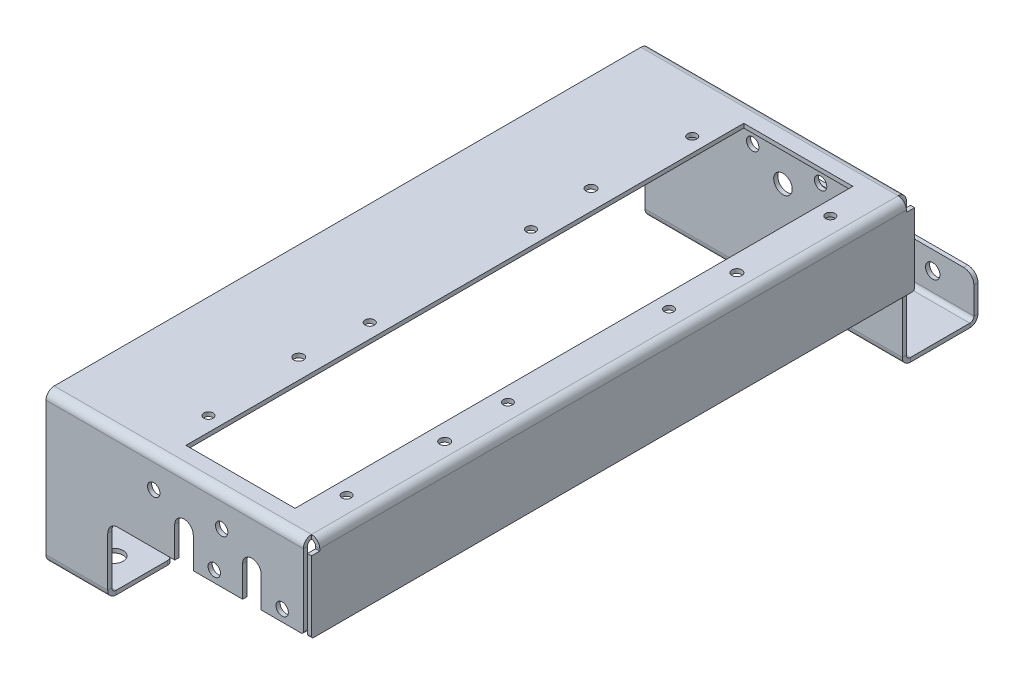
from build123d import *

# Parameters (mm, degrees)
BASE_FLANGE1_DEPTH            = 2
EDGE_FLANGE1_DEPTH            = 125
EDGE_FLANGE2_DEPTH            = 30
EDGE_FLANGE3_STRIP_W          = 12
EDGE_FLANGE3_STRIP_H          = 2
EDGE_FLANGE3_STRIP_CUT_DEPTH  = 125
EDGE_FLANGE3_DEPTH            = 125
EDGE_FLANGE4_STRIP_W          = 12
EDGE_FLANGE4_STRIP_H          = 2
EDGE_FLANGE4_STRIP_CUT_DEPTH  = 125
EDGE_FLANGE4_DEPTH            = 125
SKETCH19_W                    = 53
SKETCH19_H                    = 271
CUT_EXTRUDE2_DEPTH            = 4
M4_CLEARANCE_HOLE1_AT_2_COUNT = 2
M4_CLEARANCE_HOLE1_AT_2_PITCH = 78.333333333
M4_CLEARANCE_HOLE1_AT_3_COUNT = 2
M4_CLEARANCE_HOLE1_AT_3_PITCH = 156.666666667
M4_CLEARANCE_HOLE1_AT_4_COUNT = 2
M4_CLEARANCE_HOLE1_AT_4_PITCH = 235
M4_CLEARANCE_HOLE2_D          = 4.8
SKETCH25_R                    = 4.5
CUT_EXTRUDE3_DEPTH            = 10
CUT_EXTRUDE4_START            = -2
SKETCH26_R                    = 4.5
CUT_EXTRUDE4_DEPTH            = 2
F_6_0_6_DIAMETER_HOLE1_D      = 6
M8_CLEARANCE_HOLE1_D          = 9
M8_CLEARANCE_HOLE1_DEPTH      = 2
FILLET3_R                     = 3
M8_CLEARANCE_HOLE2_D          = 9
EDGE_FLANGE5_DEPTH            = 82.996938457
F_7_0_7_DIAMETER_HOLE1_D      = 7
F_7_0_7_DIAMETER_HOLE1_DEPTH  = 2
FILLET4_R                     = 5
EDGE_FLANGE6_DEPTH            = 285
EDGE_FLANGE6_START            = -2
EDGE_FLANGE6_FLAT_DEPTH       = 2
FILLET5_R                     = 1
FILLET6_R                     = 3


# Sheet-metal steps are written as plain solids
with BuildPart() as part:
    # Sketch1 → Base-Flange1 (new body)
    with BuildSketch(Plane.XY):
        with BuildLine():
            Line((15, 0), (-15, 0))
            Line((-15, 0), (-15, 65))
            Line((-15, 65), (110, 65))
            Line((110, 65), (110, 29))
            Line((110, 29), (20, 29))
            ThreePointArc((20, 29), (16.464466094, 27.535533906), (15, 24))
            Line((15, 24), (15, 0))
        make_face()
    extrude(amount=-BASE_FLANGE1_DEPTH)

    # Edge-Flange1 section (across the edge) → Edge-Flange1 (add)
    with BuildSketch(Plane(origin=(-15, 67, -2), x_dir=(0, -1, 0), z_dir=(1, 0, 0))):
        with BuildLine():
            Line((-2, 2), (-2, 289))
            Line((-2, 289), (0, 289))
            Line((0, 289), (0, 2))
            ThreePointArc((0, 2), (0.585786438, 0.585786438), (2, 0))
            Line((2, 0), (2, -2))
            ThreePointArc((2, -2), (-0.828427125, -0.828427125), (-2, 2))
        make_face()
    extrude(amount=EDGE_FLANGE1_DEPTH)

    # Edge-Flange2 section (across the edge) → Edge-Flange2 (add)
    with BuildSketch(Plane(origin=(15, -2, -2), x_dir=(0, 1, 0), z_dir=(-1, 0, 0))):
        with BuildLine():
            Line((-2, 2), (-2, 30))
            Line((-2, 30), (0, 30))
            Line((0, 30), (0, 2))
            ThreePointArc((0, 2), (0.585786438, 0.585786438), (2, 0))
            Line((2, 0), (2, -2))
            ThreePointArc((2, -2), (-0.828427125, -0.828427125), (-2, 2))
        make_face()
    extrude(amount=EDGE_FLANGE2_DEPTH)

    # Edge-Flange3 strip (across the edge) → Edge-Flange3 strip cut (cut)
    with BuildSketch(Plane(origin=(-15, 67, -291), x_dir=(0, 0, 1), z_dir=(1, 0, 0))):
        with Locations((-4, -1)):
            Rectangle(EDGE_FLANGE3_STRIP_W, EDGE_FLANGE3_STRIP_H)
    extrude(amount=EDGE_FLANGE3_STRIP_CUT_DEPTH, mode=Mode.SUBTRACT)

    # Edge-Flange3 section (across the edge) → Edge-Flange3 (add)
    with BuildSketch(Plane(origin=(-15, 67, -291), x_dir=(0, 0, 1), z_dir=(1, 0, 0))):
        with BuildLine():
            Line((-2, 2), (-2, 69))
            Line((-2, 69), (0, 69))
            Line((0, 69), (0, 2))
            ThreePointArc((0, 2), (0.585786438, 0.585786438), (2, 0))
            Line((2, 0), (2, -2))
            ThreePointArc((2, -2), (-0.828427125, -0.828427125), (-2, 2))
        make_face()
    extrude(amount=EDGE_FLANGE3_DEPTH)

    # Edge-Flange4 strip (across the edge) → Edge-Flange4 strip cut (cut)
    with BuildSketch(Plane(origin=(110, -2, -293), x_dir=(0, 1, 0), z_dir=(-1, 0, 0))):
        with Locations((-4, -1)):
            Rectangle(EDGE_FLANGE4_STRIP_W, EDGE_FLANGE4_STRIP_H)
    extrude(amount=EDGE_FLANGE4_STRIP_CUT_DEPTH, mode=Mode.SUBTRACT)

    # Edge-Flange4 section (across the edge) → Edge-Flange4 (add)
    with BuildSketch(Plane(origin=(110, -2, -293), x_dir=(0, 1, 0), z_dir=(-1, 0, 0))):
        with BuildLine():
            Line((-2, 2), (-2, 30.8))
            Line((-2, 30.8), (0, 30.8))
            Line((0, 30.8), (0, 2))
            ThreePointArc((0, 2), (0.585786438, 0.585786438), (2, 0))
            Line((2, 0), (2, -2))
            ThreePointArc((2, -2), (-0.828427125, -0.828427125), (-2, 2))
        make_face()
    extrude(amount=EDGE_FLANGE4_DEPTH)

    # Sketch19 → Cut-Extrude2 (cut)
    with BuildSketch(Plane(origin=(0, 69, 0), x_dir=(1, 0, 0), z_dir=(0, 1, 0))):
        with Locations((68.5, 146.5)):
            Rectangle(SKETCH19_W, SKETCH19_H)
    extrude(amount=-CUT_EXTRUDE2_DEPTH, mode=Mode.SUBTRACT)

    # Sketch22 → M4 Clearance Hole1 (revolve, cut)
    with BuildSketch(Plane(origin=(102.041079456, 69, -264), x_dir=(0, 0, 1), z_dir=(1, 0, 0))):
        Polygon((0, 0), (0, 5.351936393), (2.25, 4), (2.25, 0), align=None)
    m4_clearance_hole1 = revolve(axis=Axis((102.041079456, 75.35, -264), (0, -1, 0)), mode=Mode.SUBTRACT)

    # M4 Clearance Hole1 at 2: M4 Clearance Hole1 ×2
    with Locations(*[(0, 0, i * M4_CLEARANCE_HOLE1_AT_2_PITCH) for i in range(1, M4_CLEARANCE_HOLE1_AT_2_COUNT)]):
        add(m4_clearance_hole1, mode=Mode.SUBTRACT)

    # M4 Clearance Hole1 at 3: M4 Clearance Hole1 ×2
    with Locations(*[(0, 0, i * M4_CLEARANCE_HOLE1_AT_3_PITCH) for i in range(1, M4_CLEARANCE_HOLE1_AT_3_COUNT)]):
        add(m4_clearance_hole1, mode=Mode.SUBTRACT)

    # M4 Clearance Hole1 at 4: M4 Clearance Hole1 ×2
    with Locations(*[(0, 0, i * M4_CLEARANCE_HOLE1_AT_4_PITCH) for i in range(1, M4_CLEARANCE_HOLE1_AT_4_COUNT)]):
        add(m4_clearance_hole1, mode=Mode.SUBTRACT)

    # M4 Clearance Hole2 (through all)
    with Locations(Plane(origin=(0, 69, 0), x_dir=(1, 0, 0), z_dir=(0, 1, 0))):
        with Locations((103.2, 217.4925), (103.2, 75.4925), (32.3, 217.4925), (32.3, 75.4925)):
            Hole(M4_CLEARANCE_HOLE2_D / 2)

    # Mirror1: M4 Clearance Hole1 across plane
    add(m4_clearance_hole1.mirror(Plane.ZY.offset(-68.5)), mode=Mode.SUBTRACT)

    # Mirror1 copy 1 sketch → Mirror1 copy 1 (revolve, cut)
    with BuildSketch(Plane(origin=(34.958920544, 69, -185.666666667), x_dir=(0, 0, 1), z_dir=(-1, 0, 0))):
        Polygon((0, 0), (0, -5.351936393), (2.25, -4), (2.25, 0), align=None)
    revolve(axis=Axis((34.958920544, 75.35, -185.666666667), (0, 1, 0)), mode=Mode.SUBTRACT)

    # Mirror1 copy 2 sketch → Mirror1 copy 2 (revolve, cut)
    with BuildSketch(Plane(origin=(34.958920544, 69, -107.333333333), x_dir=(0, 0, 1), z_dir=(-1, 0, 0))):
        Polygon((0, 0), (0, -5.351936393), (2.25, -4), (2.25, 0), align=None)
    revolve(axis=Axis((34.958920544, 75.35, -107.333333333), (0, 1, 0)), mode=Mode.SUBTRACT)

    # Mirror1 copy 3 sketch → Mirror1 copy 3 (revolve, cut)
    with BuildSketch(Plane(origin=(34.958920544, 69, -29), x_dir=(0, 0, 1), z_dir=(-1, 0, 0))):
        Polygon((0, 0), (0, -5.351936393), (2.25, -4), (2.25, 0), align=None)
    revolve(axis=Axis((34.958920544, 75.35, -29), (0, 1, 0)), mode=Mode.SUBTRACT)

    # Sketch25 → Cut-Extrude3 (cut)
    with BuildSketch(Plane(origin=(0, 0, -2), x_dir=(-1, 0, 0), z_dir=(0, 0, -1))):
        with BuildLine():
            ThreePointArc((-80.541079456, 44), (-85.041079456, 39.5), (-89.541079456, 44))
            Line((-89.541079456, 44), (-89.541079456, 29))
            Line((-89.541079456, 29), (-80.541079456, 29))
            Line((-80.541079456, 29), (-80.541079456, 44))
        make_face()
        with Locations((-85.041079456, 44)):
            Circle(SKETCH25_R)
        with Locations((-52.041079456, 44)):
            Circle(SKETCH25_R)
        with BuildLine():
            Line((-56.541079456, 44), (-56.541079456, 29))
            Line((-56.541079456, 29), (-47.541079456, 29))
            Line((-47.541079456, 29), (-47.541079456, 44))
            ThreePointArc((-47.541079456, 44), (-52.041079456, 39.5), (-56.541079456, 44))
        make_face()
    extrude(amount=-CUT_EXTRUDE3_DEPTH, mode=Mode.SUBTRACT)

    # Sketch26 → Cut-Extrude4 (cut)
    with BuildSketch(Plane.XY.offset(-291).offset(CUT_EXTRUDE4_START)):
        with Locations((85.041079456, 44)):
            Circle(SKETCH26_R)
        with Locations((52.041079456, 44)):
            Circle(SKETCH26_R)
    extrude(amount=CUT_EXTRUDE4_DEPTH, mode=Mode.SUBTRACT)

    # Ø6.0 (6) Diameter Hole1 (through all)
    with Locations(Plane.XY):
        with Locations((99.738017913, 34.5), (70.344140999, 53.5), (66.738017913, 34.5), (37.344140999, 53.5)):
            Hole(F_6_0_6_DIAMETER_HOLE1_D / 2)

    # M8 Clearance Hole1
    with Locations(Plane(origin=(0, -2, 0), x_dir=(1, 0, 0), z_dir=(0, 1, 0))):
        with Locations((0, 18)):
            Hole(M8_CLEARANCE_HOLE1_D / 2, depth=M8_CLEARANCE_HOLE1_DEPTH)

    # Fillet3
    fillet3_edges = [part.edges().sort_by_distance(p)[0] for p in [
        (15, -3, -32),
        (-15, -3, -32),
    ]]
    fillet(fillet3_edges, radius=FILLET3_R)

    # M8 Clearance Hole2 (through all)
    with Locations(Plane(origin=(0, -2, 0), x_dir=(1, 0, 0), z_dir=(0, 1, 0))):
        with Locations((85, 309.4), (10, 309.4)):
            Hole(M8_CLEARANCE_HOLE2_D / 2)

    # Edge-Flange5 section (across the edge) → Edge-Flange5 (add)
    with BuildSketch(Plane(origin=(110, -2, -325.8), x_dir=(0, 0, 1), z_dir=(-1, 0, 0))):
        with BuildLine():
            Line((-2, 2), (-2, 20))
            Line((-2, 20), (0, 20))
            Line((0, 20), (0, 2))
            ThreePointArc((0, 2), (0.585786438, 0.585786438), (2, 0))
            Line((2, 0), (2, -2))
            ThreePointArc((2, -2), (-0.828427125, -0.828427125), (-2, 2))
        make_face()
    extrude(amount=EDGE_FLANGE5_DEPTH)

    # Ø7.0 (7) Diameter Hole1
    with Locations(Plane.XY.offset(-325.8)):
        with Locations((90, 9), (47.003061543, 9)):
            Hole(F_7_0_7_DIAMETER_HOLE1_D / 2, depth=F_7_0_7_DIAMETER_HOLE1_DEPTH)

    # Fillet4
    fillet4_edges = [part.edges().sort_by_distance(p)[0] for p in [
        (110, 18, -326.8),
        (27.003061543, 18, -326.8),
    ]]
    fillet(fillet4_edges, radius=FILLET4_R)

    # Edge-Flange6 bend section (across the edge) → Edge-Flange6 (add)
    with BuildSketch(Plane(origin=(112, 67, -289), x_dir=(-1, 0, 0), z_dir=(0, 0, 1))):
        with BuildLine():
            Line((-2, 2), (0, 2))
            ThreePointArc((0, 2), (0.585786438, 0.585786438), (2, 0))
            Line((2, 0), (2, -2))
            ThreePointArc((2, -2), (-0.828427125, -0.828427125), (-2, 2))
        make_face()
    extrude(amount=EDGE_FLANGE6_DEPTH)

    # Edge-Flange6 profile (on flange) → Edge-Flange6 flat (add)
    with BuildSketch(Plane(origin=(112, 67, 0), x_dir=(0, 0, -1), z_dir=(-1, 0, 0)).offset(EDGE_FLANGE6_START)):
        Polygon((4, 2), (289, 2), (289, 3), (293, 3), (293, 37.882021368), (291.992065684, 37.882021368), (1.007934316, 37.882021368), (0, 37.882021368), (0, 3), (4, 3), align=None)
    extrude(amount=EDGE_FLANGE6_FLAT_DEPTH)

    # Fillet5
    fillet5_edges = [part.edges().sort_by_distance(p)[0] for p in [
        (110, 29, -1),
        (113, 29.117978632, 0),
        (113, 29.117978632, -293),
    ]]
    fillet(fillet5_edges, radius=FILLET5_R)

    # Fillet6
    fillet6_edges = [part.edges().sort_by_distance(p)[0] for p in [
        (-15, -3, -323.8),
    ]]
    fillet(fillet6_edges, radius=FILLET6_R)


solid = part.part
